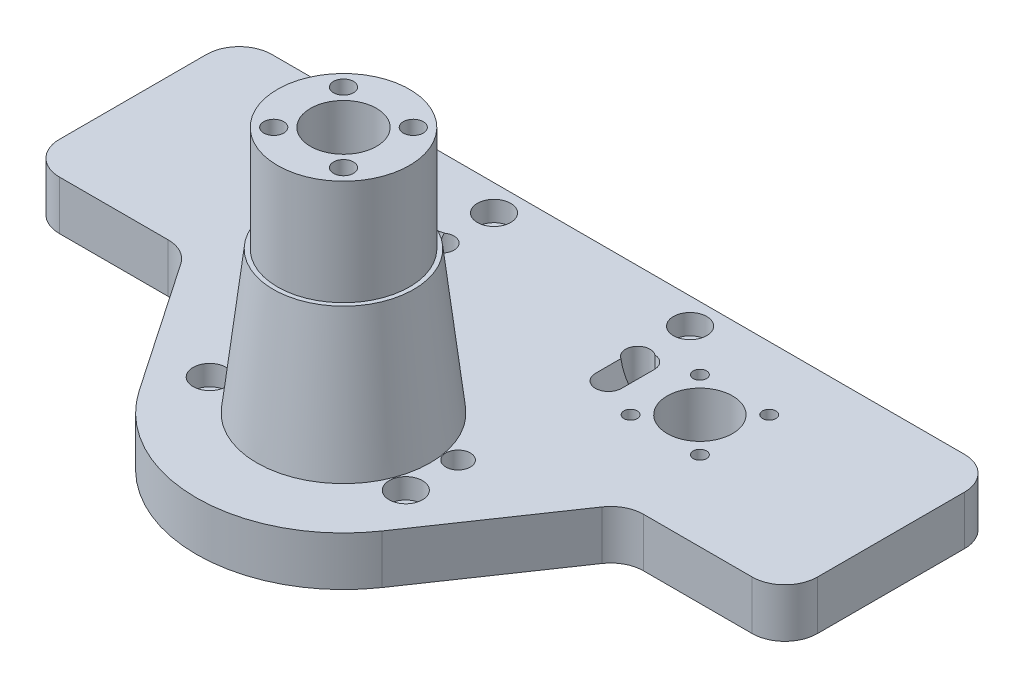
from build123d import *

# Parameters (mm, degrees)
MAIN_BODY_DEPTH                 = 15
SKETCH3_R                       = 21.5
FRONT_EXTRUSION_DEPTH           = 75.7
FRONT_LOFT_R                    = 21.5
BACK_LOFT_R                     = 26.5
SKETCH4_R                       = 10.1
SKETCH4_R_2                     = 10
SKETCH4_R_3                     = 3.05
SKETCH4_R_4                     = 3.75
SKETCH4_R_5                     = 2.05
BOLT_HOLES_DEPTH                = 170.557629059
BOLT_RECESSES_REAR_DEPTH        = 10
SKETCH6_R                       = 5.1
BOLT_RECESSES_FRONT_DEPTH       = 6.2
CUT_EXTRUDE1_START              = -32.2
SKETCH7_R                       = 21.5
SKETCH7_R_2                     = 20.2
CUT_EXTRUDE1_DEPTH              = 32.2
SKETCH8_R                       = 3.55
MOTOR_BOLT_HEAD_RECESSES_DEPTH  = 4.1
SKETCH9_R                       = 2
HEAT_SET_INSERT_HOLES_DEPTH     = 6
SKETCH10_R                      = 1.6
PCB_HEAT_SET_INSERT_HOLES_DEPTH = 4
SKETCH11_R                      = 2
CUT_EXTRUDE2_DEPTH              = 6


with BuildPart() as part:
    # Sketch1 → Main Body (new body)
    with BuildSketch(Plane(origin=(0, 0, 0), x_dir=(1, 0, 0), z_dir=(0, 1, 0))):
        with BuildLine():
            Line((55, 84.067232452), (-55, 84.067232452))
            Line((-55, 84.067232452), (-106, 84.067232452))
            ThreePointArc((-106, 84.067232452), (-113.071067812, 81.138300264), (-116, 74.067232452))
            Line((-116, 74.067232452), (-116, 29.067232452))
            ThreePointArc((-116, 29.067232452), (-113.071067812, 21.99616464), (-106, 19.067232452))
            Line((-106, 19.067232452), (-72.737775696, 19.067232452))
            ThreePointArc((-72.737775696, 19.067232452), (-68.06426999, 17.90795326), (-64.474343867, 14.698901335))
            Line((-64.474343867, 14.698901335), (-37.18544323, -25.342509974))
            ThreePointArc((-37.18544323, -25.342509974), (0, -45), (37.18544323, -25.342509974))
            Line((37.18544323, -25.342509974), (64.474343867, 14.698901335))
            ThreePointArc((64.474343867, 14.698901335), (68.06426999, 17.90795326), (72.737775696, 19.067232452))
            Line((72.737775696, 19.067232452), (106, 19.067232452))
            ThreePointArc((106, 19.067232452), (113.071067812, 21.99616464), (116, 29.067232452))
            Line((116, 29.067232452), (116, 74.067232452))
            ThreePointArc((116, 74.067232452), (113.071067812, 81.138300264), (106, 84.067232452))
            Line((106, 84.067232452), (55, 84.067232452))
        make_face()
    extrude(amount=MAIN_BODY_DEPTH)

    # Sketch3 → Front Extrusion (add)
    with BuildSketch(Plane(origin=(0, 15, 0), x_dir=(1, 0, 0), z_dir=(0, 1, 0))):
        with Locations(Location((0, 0, 0), (0, 0, 270))):
            Circle(SKETCH3_R)
    extrude(amount=FRONT_EXTRUSION_DEPTH)

    # Front Loft → Lofted Taper section 0
    with BuildSketch(Plane(origin=(0, 58.5, 0), x_dir=(1, 0, 0), z_dir=(0, 1, 0))):
        Circle(FRONT_LOFT_R)
    # Back Loft → Lofted Taper section 1
    with BuildSketch(Plane(origin=(0, 15, 0), x_dir=(1, 0, 0), z_dir=(0, 1, 0))):
        Circle(BACK_LOFT_R)
    loft()

    # Sketch4 → Bolt Holes (cut, through all)
    with BuildSketch(Plane.XZ):
        with Locations(Location((0, 0, 0), (0, 0, 270))):
            Circle(SKETCH4_R)
        with Locations(Location((-55, -54.067232452, 0), (0, 0, 270))):
            Circle(SKETCH4_R_2)
        with Locations(Location((-10.677312396, 10.677312396, 0), (0, 0, 270))):
            Circle(SKETCH4_R_3)
        with Locations(Location((-30, -60.067232452, 0), (0, 0, 270))):
            Circle(SKETCH4_R_4)
        with Locations(Location((-10.677312396, -10.677312396, 0), (0, 0, 90))):
            Circle(SKETCH4_R_3)
        with Locations(Location((-65.606601718, -43.460630734, 0), (0, 0, 270))):
            Circle(SKETCH4_R_5)
        with Locations(Location((-65.606601718, -64.67383417, 0), (0, 0, 90))):
            Circle(SKETCH4_R_5)
        with Locations(Location((-44.393398282, -64.67383417, 0), (0, 0, 270))):
            Circle(SKETCH4_R_5)
        with Locations(Location((-44.393398282, -43.460630734, 0), (0, 0, 90))):
            Circle(SKETCH4_R_5)
        with Locations(Location((55, -54.067232452, 0), (0, 0, 90))):
            Circle(SKETCH4_R_2)
        with Locations(Location((65.606601718, -64.67383417, 0), (0, 0, 270))):
            Circle(SKETCH4_R_5)
        with Locations(Location((44.393398282, -64.67383417, 0), (0, 0, 90))):
            Circle(SKETCH4_R_5)
        with Locations(Location((44.393398282, -43.460630734, 0), (0, 0, 270))):
            Circle(SKETCH4_R_5)
        with Locations(Location((65.606601718, -43.460630734, 0), (0, 0, 90))):
            Circle(SKETCH4_R_5)
        with Locations(Location((10.677312396, -10.677312396, 0), (0, 0, 270))):
            Circle(SKETCH4_R_3)
        with Locations(Location((10.677312396, 10.677312396, 0), (0, 0, 90))):
            Circle(SKETCH4_R_3)
        with Locations(Location((-30, -76.067232452, 0), (0, 0, 270))):
            Circle(SKETCH4_R_3)
        with Locations(Location((-30, 10.932767548, 0), (0, 0, 270))):
            Circle(SKETCH4_R_3)
        with Locations(Location((30, -76.067232452, 0), (0, 0, 90))):
            Circle(SKETCH4_R_3)
        with Locations(Location((30, 10.932767548, 0), (0, 0, 90))):
            Circle(SKETCH4_R_3)
        with Locations(Location((-30, -5.067232452, 0), (0, 0, 270))):
            Circle(SKETCH4_R_4)
        with Locations(Location((30, -60.067232452, 0), (0, 0, 90))):
            Circle(SKETCH4_R_4)
        with Locations(Location((30, -5.067232452, 0), (0, 0, 90))):
            Circle(SKETCH4_R_4)
    extrude(amount=-BOLT_HOLES_DEPTH, mode=Mode.SUBTRACT)

    # Sketch5 → Bolt Recesses Rear (cut)
    with BuildSketch(Plane.XZ):
        with BuildLine():
            Line((-14.28355698, 7.071067812), (-9.770658587, 2.558169419))
            ThreePointArc((-9.770658587, 2.558169419), (-7.14177849, 7.14177849), (-2.558169419, 9.770658587))
            Line((-2.558169419, 9.770658587), (-7.071067812, 14.28355698))
            ThreePointArc((-7.071067812, 14.28355698), (-14.28355698, 14.28355698), (-14.28355698, 7.071067812))
        make_face()
        with BuildLine():
            Line((-14.28355698, -7.071067812), (-9.770658587, -2.558169419))
            ThreePointArc((-9.770658587, -2.558169419), (-7.14177849, -7.14177849), (-2.558169419, -9.770658587))
            Line((-2.558169419, -9.770658587), (-7.071067812, -14.28355698))
            ThreePointArc((-7.071067812, -14.28355698), (-14.28355698, -14.28355698), (-14.28355698, -7.071067812))
        make_face()
        with BuildLine():
            Line((7.071067812, -14.28355698), (2.558169419, -9.770658587))
            ThreePointArc((2.558169419, -9.770658587), (7.14177849, -7.14177849), (9.770658587, -2.558169419))
            Line((9.770658587, -2.558169419), (14.28355698, -7.071067812))
            ThreePointArc((14.28355698, -7.071067812), (14.28355698, -14.28355698), (7.071067812, -14.28355698))
        make_face()
        with BuildLine():
            Line((14.28355698, 7.071067812), (9.770658587, 2.558169419))
            ThreePointArc((9.770658587, 2.558169419), (7.14177849, 7.14177849), (2.558169419, 9.770658587))
            Line((2.558169419, 9.770658587), (7.071067812, 14.28355698))
            ThreePointArc((7.071067812, 14.28355698), (14.28355698, 14.28355698), (14.28355698, 7.071067812))
        make_face()
    extrude(amount=-BOLT_RECESSES_REAR_DEPTH, mode=Mode.SUBTRACT)

    # Sketch6 → Bolt Recesses Front (cut)
    with BuildSketch(Plane(origin=(0, 15, 0), x_dir=(1, 0, 0), z_dir=(0, 1, 0))):
        with Locations(Location((30, 76.067232452, 0), (0, 0, 270))):
            Circle(SKETCH6_R)
        with Locations(Location((-30, 76.067232452, 0), (0, 0, 270))):
            Circle(SKETCH6_R)
        with Locations(Location((-30, -10.932767548, 0), (0, 0, 270))):
            Circle(SKETCH6_R)
        with Locations(Location((30, -10.932767548, 0), (0, 0, 270))):
            Circle(SKETCH6_R)
    extrude(amount=-BOLT_RECESSES_FRONT_DEPTH, mode=Mode.SUBTRACT)

    # Sketch7 → Cut-Extrude1 (cut)
    with BuildSketch(Plane(origin=(0, 90.7, 0), x_dir=(1, 0, 0), z_dir=(0, 1, 0)).offset(CUT_EXTRUDE1_START)):
        Circle(SKETCH7_R)
        with Locations(Location((0, 0, 0), (0, 0, 270))):
            Circle(SKETCH7_R_2, mode=Mode.SUBTRACT)
    extrude(amount=CUT_EXTRUDE1_DEPTH, mode=Mode.SUBTRACT)

    # Sketch8 → Motor bolt head recesses (cut)
    with BuildSketch(Plane.XZ):
        with Locations(Location((-65.606601718, -43.460630734, 0), (0, 0, 270))):
            Circle(SKETCH8_R)
        with Locations(Location((-44.393398282, -43.460630734, 0), (0, 0, 270))):
            Circle(SKETCH8_R)
        with Locations(Location((-44.393398282, -64.67383417, 0), (0, 0, 270))):
            Circle(SKETCH8_R)
        with Locations(Location((-65.606601718, -64.67383417, 0), (0, 0, 270))):
            Circle(SKETCH8_R)
        with Locations(Location((44.393398282, -64.67383417, 0), (0, 0, 90))):
            Circle(SKETCH8_R)
        with Locations(Location((44.393398282, -43.460630734, 0), (0, 0, 90))):
            Circle(SKETCH8_R)
        with Locations(Location((65.606601718, -64.67383417, 0), (0, 0, 90))):
            Circle(SKETCH8_R)
        with Locations(Location((65.606601718, -43.460630734, 0), (0, 0, 90))):
            Circle(SKETCH8_R)
    extrude(amount=-MOTOR_BOLT_HEAD_RECESSES_DEPTH, mode=Mode.SUBTRACT)

    # Sketch9 → Heat-set insert holes (cut)
    with BuildSketch(Plane.XZ):
        with Locations(Location((-111, -75.067232452, 0), (0, 0, 270))):
            Circle(SKETCH9_R)
        with Locations(Location((-111, -28.067232452, 0), (0, 0, 270))):
            Circle(SKETCH9_R)
        with Locations(Location((-41, -28.067232452, 0), (0, 0, 270))):
            Circle(SKETCH9_R)
        with Locations(Location((-41, -75.067232452, 0), (0, 0, 270))):
            Circle(SKETCH9_R)
        with Locations(Location((41, -75.067232452, 0), (0, 0, 90))):
            Circle(SKETCH9_R)
        with Locations(Location((111, -75.067232452, 0), (0, 0, 90))):
            Circle(SKETCH9_R)
        with Locations(Location((41, -28.067232452, 0), (0, 0, 90))):
            Circle(SKETCH9_R)
        with Locations(Location((111, -28.067232452, 0), (0, 0, 90))):
            Circle(SKETCH9_R)
    extrude(amount=-HEAT_SET_INSERT_HOLES_DEPTH, mode=Mode.SUBTRACT)

    # Sketch10 → PCB Heat-set insert holes (cut)
    with BuildSketch(Plane.XZ):
        with Locations(Location((-101.5, -76.567232452, 0), (0, 0, 270))):
            Circle(SKETCH10_R)
        with Locations(Location((-101.5, -26.567232452, 0), (0, 0, 270))):
            Circle(SKETCH10_R)
        with Locations(Location((-51.5, -26.567232452, 0), (0, 0, 270))):
            Circle(SKETCH10_R)
        with Locations(Location((-51.5, -76.567232452, 0), (0, 0, 270))):
            Circle(SKETCH10_R)
        with Locations(Location((101.5, -76.567232452, 0), (0, 0, 90))):
            Circle(SKETCH10_R)
        with Locations(Location((51.5, -76.567232452, 0), (0, 0, 90))):
            Circle(SKETCH10_R)
        with Locations(Location((51.5, -26.567232452, 0), (0, 0, 90))):
            Circle(SKETCH10_R)
        with Locations(Location((101.5, -26.567232452, 0), (0, 0, 90))):
            Circle(SKETCH10_R)
    extrude(amount=-PCB_HEAT_SET_INSERT_HOLES_DEPTH, mode=Mode.SUBTRACT)

    # Sketch11 → Cut-Extrude2 (cut)
    with BuildSketch(Plane(origin=(0, 0, -84.067232452), x_dir=(-1, 0, 0), z_dir=(0, 0, -1))):
        with Locations((-20, 7.5)):
            Circle(SKETCH11_R)
        with Locations(Location((20, 7.5, 0), (0, 0, 180))):
            Circle(SKETCH11_R)
    extrude(amount=-CUT_EXTRUDE2_DEPTH, mode=Mode.SUBTRACT)

    # Cut-Loft4: read off the stored shape, not the designer's step
    # Cut-Loft4: loft between two sections, ruled curve by curve
    cut_loft4_from = [
        Edge.make_bspline([(-36.038074994, 15, -54.067232452), (-36.038074994, 15, -54.988781948), (-36.038074994, 15, -56.831880942), (-36.038074994, 15, -58.370407575), (-36.038074994, 15, -59.659085451), (-35.779393497, 15, -60.769573008), (-34.82798476, 15, -62.074241278), (-33.742870403, 15, -62.742739165), (-32.779895841, 15, -63.023675898), (-32.038074994, 15, -63.088047376), (-31.296254147, 15, -63.023675898), (-30.333279584, 15, -62.742739165), (-29.248165227, 15, -62.074241278), (-28.29675649, 15, -60.769573008), (-28.038074994, 15, -59.659085451), (-28.038074994, 15, -58.370407575), (-28.038074994, 15, -56.831880942), (-28.038074994, 15, -54.067232452), (-28.038074994, 15, -51.302583962), (-28.038074994, 15, -49.764057329), (-28.038074994, 15, -48.475379453), (-28.29675649, 15, -47.364891896), (-29.248165227, 15, -46.060223626), (-30.333279584, 15, -45.391725739), (-31.296254147, 15, -45.110789006), (-32.038074994, 15, -45.046417527), (-32.779895841, 15, -45.110789006), (-33.742870403, 15, -45.391725739), (-34.82798476, 15, -46.060223626), (-35.779393497, 15, -47.364891896), (-36.038074994, 15, -48.475379453), (-36.038074994, 15, -49.764057329), (-36.038074994, 15, -51.302583962), (-36.038074994, 15, -53.145682955), (-36.038074994, 15, -54.067232452)], [0.592636723, 0.592636723, 0.592636723, 0.592636723, 0.638955085, 0.685273447, 0.685273447, 0.724614266, 0.763955085, 0.803295904, 0.822966314, 0.842636723, 0.862307133, 0.881977543, 0.921318362, 0.960659181, 1, 1, 1.046318362, 1.092636723, 1.138955085, 1.185273447, 1.185273447, 1.224614266, 1.263955085, 1.303295904, 1.322966314, 1.342636723, 1.362307133, 1.381977543, 1.421318362, 1.460659181, 1.5, 1.5, 1.546318362, 1.592636723, 1.592636723, 1.592636723, 1.592636723], 3),
    ]
    cut_loft4_to = [
        Edge.make_bspline([(-42.125492134, 0, -54.067232452), (-42.125492134, 0, -54.371640737), (-42.125492134, 0, -54.980457307), (-42.125492134, 0, -55.652689971), (-42.125492134, 0, -56.419326957), (-42.000266634, 0, -57.149561473), (-41.384144916, 0, -58.161783988), (-40.543378211, 0, -58.768333152), (-39.750358502, 0, -59.023013183), (-39.125492134, 0, -59.089698282), (-38.500625766, 0, -59.023013183), (-37.707606056, 0, -58.768333152), (-36.866839351, 0, -58.161783988), (-36.250717633, 0, -57.149561473), (-36.125492134, 0, -56.419326957), (-36.125492134, 0, -55.652689971), (-36.125492134, 0, -54.980457307), (-36.125492134, 0, -54.067232452), (-36.125492134, 0, -53.154007596), (-36.125492134, 0, -52.481774932), (-36.125492134, 0, -51.715137947), (-36.250717633, 0, -50.984903431), (-36.866839351, 0, -49.972680915), (-37.707606056, 0, -49.366131752), (-38.500625766, 0, -49.111451721), (-39.125492134, 0, -49.044766622), (-39.750358502, 0, -49.111451721), (-40.543378211, 0, -49.366131752), (-41.384144916, 0, -49.972680915), (-42.000266634, 0, -50.984903431), (-42.125492134, 0, -51.715137947), (-42.125492134, 0, -52.481774932), (-42.125492134, 0, -53.154007596), (-42.125492134, 0, -53.762824167), (-42.125492134, 0, -54.067232452)], [0.592636723, 0.592636723, 0.592636723, 0.592636723, 0.638955085, 0.685273447, 0.685273447, 0.724614266, 0.763955085, 0.803295904, 0.822966314, 0.842636723, 0.862307133, 0.881977543, 0.921318362, 0.960659181, 1, 1, 1.046318362, 1.092636723, 1.138955085, 1.185273447, 1.185273447, 1.224614266, 1.263955085, 1.303295904, 1.322966314, 1.342636723, 1.362307133, 1.381977543, 1.421318362, 1.460659181, 1.5, 1.5, 1.546318362, 1.592636723, 1.592636723, 1.592636723, 1.592636723], 3),
    ]
    cut_loft4 = Solid(Shell([*[Face.make_surface_from_curves(cut_loft4_from[k], cut_loft4_to[k]) for k in range(1)], Face(Wire(cut_loft4_from)), Face(Wire(cut_loft4_to))]))
    add(cut_loft4, mode=Mode.SUBTRACT)

    # Mirror1: Cut-Loft4 across plane
    add(cut_loft4.mirror(Plane(origin=(0, 0, 0), x_dir=(0, 0, 1), z_dir=(1, 0, 0))), mode=Mode.SUBTRACT)


solid = part.part
